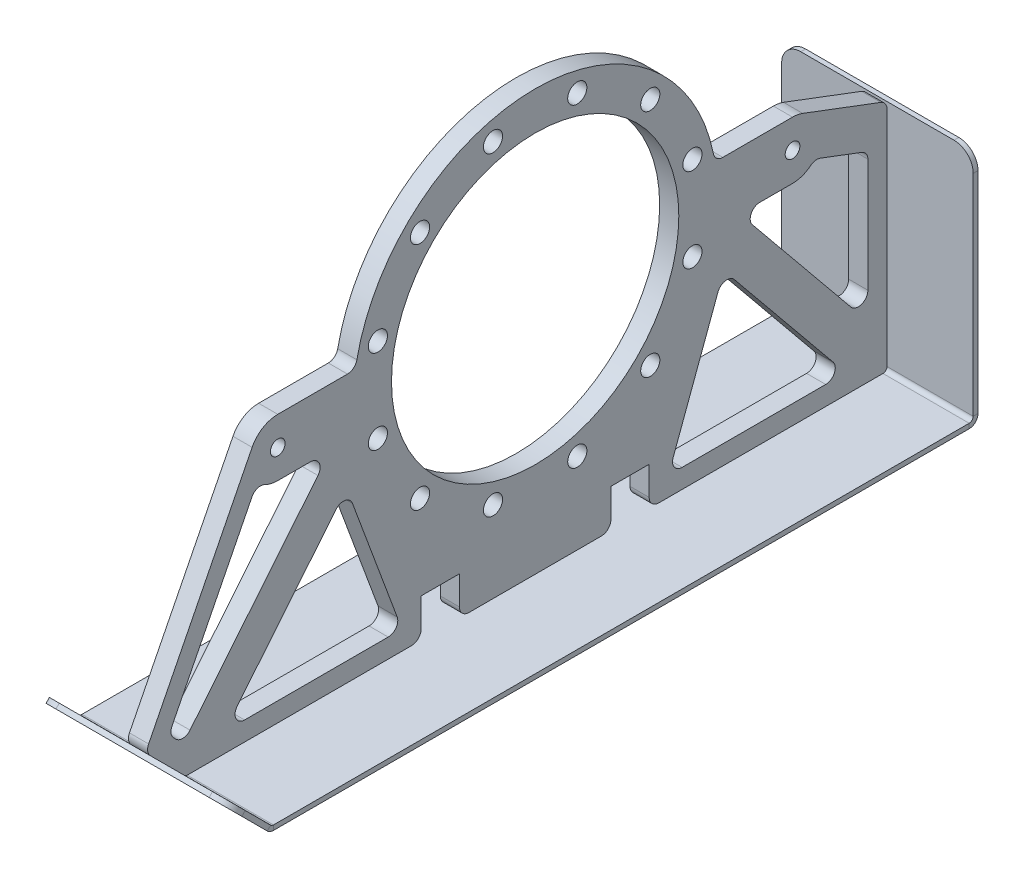
from build123d import *

# Parameters (mm, degrees)
FLANGE_PROFILE_DEPTH                = 12.7
F_7_8_1_DIAMETER_HOLE1_D            = 25.4
BOLT_PATTERN_COUNT                  = 12
SKETCH15_R                          = 9.72312
BOSS_EXTRUDE1_DEPTH                 = 12.7
SKETCH5_W                           = 254
SKETCH5_H                           = 1317.865260112
BASE_SKID_DEPTH                     = 6.35
BEND_START                          = -127
BEND_HEEL_DEPTH                     = 254
BEND_HEEL_2_DEPTH                   = 254
BEND_TOE_DEPTH                      = 254
BEND_TOE_2_DEPTH                    = 254
WEBBING_EXTRUDE_DEPTH               = 12.7
WEBBING_FILLET_R                    = 12.7
SKID_START                          = -472.929130056
SKID_EDGES_DEPTH                    = 6.35
SKID_START_2                        = -334.061851681
SKID_EDGES_2_DEPTH                  = 6.35
FLANGE_FILLET_R                     = 12.7
CONVERT_START                       = -12.7
CONVERT_FLANGE_TO_SHEET_OUTLINE_R   = 12.7
CONVERT_FLANGE_TO_SHEET_OUTLINE_R_2 = 9.72312
CONVERT_FLANGE_TO_SHEET_OUTLINE_R_3 = 190.5
CONVERT_FLANGE_TO_SHEET_DEPTH       = 25.4


# Read off the part's stored shape, not the designer's step: Bend Heel, Bend Toe, Skid Edges, Convert Flange to Sheet
# Sheet-metal steps are written as plain solids
with BuildPart() as part:
    # Sketch1 → Flange Profile (new, symmetric)
    with BuildSketch(Plane(origin=(0, 0, 0), x_dir=(0, 0, -1), z_dir=(1, 0, 0))):
        with BuildLine():
            ThreePointArc((-190.5, 316.3), (0, 506.8), (190.5, 316.3))
            Line((190.5, 316.3), (241.3, 316.3))
            ThreePointArc((241.3, 316.3), (0, 557.6), (-241.3, 316.3))
            Line((-241.3, 316.3), (-190.5, 316.3))
        make_face()
        with BuildLine():
            Line((241.3, 316.3), (190.5, 316.3))
            ThreePointArc((190.5, 316.3), (0, 125.8), (-190.5, 316.3))
            Line((-190.5, 316.3), (-241.3, 316.3))
            ThreePointArc((-241.3, 316.3), (0, 75), (241.3, 316.3))
        make_face()
    extrude(amount=FLANGE_PROFILE_DEPTH, both=True)

    # 7/8 (1) Diameter Hole1 (through all)
    with Locations(Plane(origin=(12.7, 260.420968162, -208.543385896), x_dir=(0, 0, 1), z_dir=(1, 0, 0))):
        with Locations((0, 0)):
            f_7_8_1_diameter_hole1 = Hole(F_7_8_1_DIAMETER_HOLE1_D / 2)

    # Bolt Pattern: 7/8 (1) Diameter Hole1 ×12 about axis
    bolt_pattern_axis = Axis((0, 316.3, 0), (1, 0, 0))
    for i in range(1, BOLT_PATTERN_COUNT):
        add(f_7_8_1_diameter_hole1.rotate(bolt_pattern_axis, i * 360 / BOLT_PATTERN_COUNT), mode=Mode.SUBTRACT)

    # Sketch15 → Boss-Extrude1 (add, symmetric)
    with BuildSketch(Plane(origin=(0, 0, 0), x_dir=(0, 0, -1), z_dir=(1, 0, 0))):
        with BuildLine():
            Line((-238.273120599, 278.2), (-341.3, 278.2))
            ThreePointArc((-341.3, 278.2), (-379.4, 316.3), (-341.3, 354.4))
            Line((-341.3, 354.4), (-238.273120599, 354.4))
            ThreePointArc((-238.273120599, 354.4), (-200.173120599, 316.3), (-238.273120599, 278.2))
        make_face()
        with Locations((-341.3, 316.3)):
            Circle(SKETCH15_R, mode=Mode.SUBTRACT)
    boss_extrude1 = extrude(amount=BOSS_EXTRUDE1_DEPTH, both=True)

    # Mirror2: Boss-Extrude1 across plane
    add(boss_extrude1.mirror(Plane.XY))

    # webbing → Webbing Extrude (add, symmetric)
    with BuildSketch(Plane(origin=(0, 0, 0), x_dir=(0, 0, -1), z_dir=(1, 0, 0))):
        with BuildLine():
            ThreePointArc((238.273120599, 278.2), (0, 75), (-238.273120599, 278.2))
            Line((-238.273120599, 278.2), (-271.07641131, 278.2))
            Line((-271.07641131, 278.2), (-466.535353829, 39.001833116))
            Line((-466.535353829, 39.001833116), (-485.744094857, 58.210574144))
            Line((-485.744094857, 58.210574144), (-380.664844281, 266.473711409))
            Line((-380.664844281, 266.473711409), (-368.819522655, 289.950695021))
            ThreePointArc((-368.819522655, 289.950695021), (-378.982374479, 310.674286388), (-375.315537192, 333.462553119))
            Line((-375.315537192, 333.462553119), (-516.69946035, 53.244915153))
            Line((-516.69946035, 53.244915153), (-465.016837626, 1.562292429))
            ThreePointArc((-465.016837626, 1.562292429), (-463.286363484, 0.406026574), (-461.245130056, 0))
            Line((-461.245130056, 0), (-151.213153751, 0))
            Line((-151.213153751, 0), (-151.213153751, 50.8))
            Line((-151.213153751, 50.8), (-100.413153751, 50.8))
            Line((-100.413153751, 50.8), (-100.413153751, 0))
            Line((-100.413153751, 0), (100.413153751, 0))
            Line((100.413153751, 0), (100.413153751, 50.8))
            Line((100.413153751, 50.8), (151.213153751, 50.8))
            Line((151.213153751, 50.8), (151.213153751, 0))
            Line((151.213153751, 0), (176.613153751, 0))
            Line((176.613153751, 0), (461.245130056, 0))
            ThreePointArc((461.245130056, 0), (465.016837626, 1.562292429), (466.579130056, 5.334))
            Line((466.579130056, 5.334), (466.579130056, 309.66453199))
            Line((466.579130056, 309.66453199), (354.774573435, 351.937702939))
            ThreePointArc((354.774573435, 351.937702939), (378.177611201, 325.873494246), (370.408024073, 291.716816021))
            Line((370.408024073, 291.716816021), (441.179130056, 264.958344347))
            Line((441.179130056, 264.958344347), (441.179130056, 70.03219769))
            Line((441.179130056, 70.03219769), (271.07641131, 278.2))
            Line((271.07641131, 278.2), (238.273120599, 278.2))
        make_face()
        Polygon((-176.613153751, 25.4), (-412.046717792, 25.4), (-250.076782577, 223.615088522), align=None, mode=Mode.SUBTRACT)
        Polygon((412.046717792, 25.4), (176.613153751, 25.4), (250.076782577, 223.615088522), align=None, mode=Mode.SUBTRACT)
    extrude(amount=WEBBING_EXTRUDE_DEPTH, both=True)

    # Webbing Fillet
    webbing_fillet_edges = [part.edges().sort_by_distance(p)[0] for p in [
        (0, 25.4, 412.046717792),
        (0, 223.615088522, 250.076782577),
        (0, 289.950695021, 368.819522655),
        (0, 291.716816021, -370.408024073),
        (0, 264.958344347, -441.179130056),
        (0, 70.03219769, -441.179130056),
        (0, 278.2, -271.07641131),
        (0, 278.2, 271.07641131),
        (0, 39.001833116, 466.535353829),
        (0, 25.4, -412.046717792),
        (0, 25.4, -176.613153751),
        (0, 58.210574144, 485.744094857),
        (0, 223.615088522, -250.076782577),
        (0, 25.4, 176.613153751),
    ]]
    fillet(webbing_fillet_edges, radius=WEBBING_FILLET_R)

    # Flange Fillet
    flange_fillet_edges = [part.edges().sort_by_distance(p)[0] for p in [
        (0, 53.244915153, 516.69946035),
        (0, 0, 151.213153751),
        (0, 0, 100.413153751),
        (0, 0, -100.413153751),
        (0, 0, -151.213153751),
        (0, 309.66453199, -466.579130056),
        (0, 354.4, 238.273120599),
        (0, 354.4, -238.273120599),
    ]]
    fillet(flange_fillet_edges, radius=FLANGE_FILLET_R)


with BuildPart() as body_2:
    # Sketch5 → Base Skid (new body)
    with BuildSketch(Plane(origin=(0, 0, 0), x_dir=(1, 0, 0), z_dir=(0, 1, 0))):
        with Locations((0, 118.6125)):
            Rectangle(SKETCH5_W, SKETCH5_H)
    extrude(amount=-BASE_SKID_DEPTH)

    # Bend Heel outline → Bend Heel (cut)
    with BuildSketch(Plane.YZ.offset(BEND_START)):
        with BuildLine():
            Line((0, -777.545130056), (0, -471.640528076))
            ThreePointArc((0, -471.640528076), (-4.636915504, -467.33583609), (-6.35, -461.245130056))
            Line((-6.35, -461.245130056), (-6.35, -777.545130056))
            Line((-6.35, -777.545130056), (0, -777.545130056))
        make_face()
    extrude(amount=BEND_HEEL_DEPTH, mode=Mode.SUBTRACT)

    # Bend Heel 2 outline → Bend Heel 2 (add)
    with BuildSketch(Plane.YZ.offset(BEND_START)):
        with BuildLine():
            Line((5.334, -472.929130056), (309.66453199, -472.929130056))
            Line((309.66453199, -472.929130056), (309.66453199, -466.579130056))
            Line((309.66453199, -466.579130056), (5.334, -466.579130056))
            ThreePointArc((5.334, -466.579130056), (1.56229243, -465.016837626), (0, -461.245130056))
            Line((0, -461.245130056), (0, -471.640528076))
            ThreePointArc((0, -471.640528076), (2.590277571, -472.602411563), (5.334, -472.929130056))
        make_face()
    extrude(amount=BEND_HEEL_2_DEPTH)

    # Bend Toe outline → Bend Toe (cut)
    with BuildSketch(Plane.YZ.offset(BEND_START)):
        with BuildLine():
            Line((-6.35, 540.320130056), (-6.35, 461.245130056))
            ThreePointArc((-6.35, 461.245130056), (-5.460608458, 465.71640328), (-2.927835631, 469.506965687))
            Line((-2.927835631, 469.506965687), (0, 472.434801318))
            Line((0, 472.434801318), (0, 540.320130056))
            Line((0, 540.320130056), (-6.35, 540.320130056))
        make_face()
    extrude(amount=BEND_TOE_DEPTH, mode=Mode.SUBTRACT)

    # Bend Toe 2 outline → Bend Toe 2 (add)
    with BuildSketch(Plane.YZ.offset(BEND_START)):
        with BuildLine():
            Line((48.754787092, 521.189588411), (0, 472.434801318))
            Line((0, 472.434801318), (0, 461.245130056))
            ThreePointArc((0, 461.245130056), (0.406026574, 463.286363484), (1.562292429, 465.016837626))
            Line((1.562292429, 465.016837626), (53.244915153, 516.69946035))
            Line((53.244915153, 516.69946035), (48.754787092, 521.189588411))
        make_face()
    extrude(amount=BEND_TOE_2_DEPTH)

    # Skid Edges outline → Skid Edges (cut)
    with BuildSketch(Plane.XY.offset(SKID_START)):
        with BuildLine():
            ThreePointArc((-127, 284.26453199), (-119.560512242, 302.225044232), (-101.6, 309.66453199))
            Line((-101.6, 309.66453199), (-127, 309.66453199))
            Line((-127, 309.66453199), (-127, 284.26453199))
        make_face()
        with BuildLine():
            ThreePointArc((101.6, 309.66453199), (119.560512242, 302.225044232), (127, 284.26453199))
            Line((127, 284.26453199), (127, 309.66453199))
            Line((127, 309.66453199), (101.6, 309.66453199))
        make_face()
    extrude(amount=SKID_EDGES_DEPTH, mode=Mode.SUBTRACT)

    # Skid Edges 2 outline → Skid Edges 2 (cut)
    with BuildSketch(Plane(origin=(0, 0, 0), x_dir=(1, 0, 0), z_dir=(0, 0.707106781186546, -0.707106781186549)).offset(SKID_START_2)):
        with BuildLine():
            Line((-127, -403.011532817), (-101.6, -403.011532817))
            ThreePointArc((-101.6, -403.011532817), (-119.560512242, -395.572045059), (-127, -377.611532817))
            Line((-127, -377.611532817), (-127, -403.011532817))
        make_face()
        with BuildLine():
            ThreePointArc((127, -377.611532817), (119.560512242, -395.572045059), (101.6, -403.011532817))
            Line((101.6, -403.011532817), (127, -403.011532817))
            Line((127, -403.011532817), (127, -377.611532817))
        make_face()
    extrude(amount=SKID_EDGES_2_DEPTH, mode=Mode.SUBTRACT)


with BuildPart() as body_3:
    # Convert Flange to Sheet outline → Convert Flange to Sheet (new body)
    with BuildSketch(Plane.YZ.offset(CONVERT_START)):
        with BuildLine():
            ThreePointArc((354.4, 341.3), (348.746134391, 361.271438683), (333.462553119, 375.315537192))
            Line((333.462553119, 375.315537192), (61.448595688, 512.560290001))
            ThreePointArc((61.448595688, 512.560290001), (53.716209529, 513.761463663), (46.747488527, 510.202033725))
            Line((46.747488527, 510.202033725), (1.562292429, 465.016837626))
            ThreePointArc((1.562292429, 465.016837626), (0.406026574, 463.286363484), (0, 461.245130056))
            Line((0, 461.245130056), (0, 163.913153751))
            ThreePointArc((0, 163.913153751), (3.719743879, 154.93289763), (12.7, 151.213153751))
            Line((12.7, 151.213153751), (50.8, 151.213153751))
            Line((50.8, 151.213153751), (50.8, 100.413153751))
            Line((50.8, 100.413153751), (12.7, 100.413153751))
            ThreePointArc((12.7, 100.413153751), (3.719743879, 96.693409872), (0, 87.713153751))
            Line((0, 87.713153751), (0, -87.713153751))
            ThreePointArc((0, -87.713153751), (3.719743879, -96.693409872), (12.7, -100.413153751))
            Line((12.7, -100.413153751), (50.8, -100.413153751))
            Line((50.8, -100.413153751), (50.8, -151.213153751))
            Line((50.8, -151.213153751), (12.7, -151.213153751))
            ThreePointArc((12.7, -151.213153751), (3.719743879, -154.93289763), (0, -163.913153751))
            Line((0, -163.913153751), (0, -461.245130056))
            ThreePointArc((0, -461.245130056), (1.56229243, -465.016837626), (5.334, -466.579130056))
            Line((5.334, -466.579130056), (300.888912587, -466.579130056))
            ThreePointArc((300.888912587, -466.579130056), (308.108595375, -464.327392133), (312.7681469, -458.370654534))
            Line((312.7681469, -458.370654534), (351.937702939, -354.774573435))
            ThreePointArc((351.937702939, -354.774573435), (353.779370872, -348.148850927), (354.4, -341.3))
            Line((354.4, -341.3), (354.4, -248.868157867))
            ThreePointArc((354.4, -248.868157867), (357.262622301, -240.83597261), (364.56, -236.424749973))
            ThreePointArc((364.56, -236.424749973), (557.6, 0), (364.56, 236.424749973))
            ThreePointArc((364.56, 236.424749973), (357.262622301, 240.83597261), (354.4, 248.868157867))
            Line((354.4, 248.868157867), (354.4, 341.3))
        make_face()
        with BuildLine():
            ThreePointArc((46.135994814, -395.102459099), (32.65790179, -396.74310345), (25.4, -385.26819312))
            Line((25.4, -385.26819312), (25.4, -194.864301774))
            ThreePointArc((25.4, -194.864301774), (30.846114958, -184.439756133), (42.513567213, -182.955883556))
            Line((42.513567213, -182.955883556), (202.817491303, -242.368656148))
            ThreePointArc((202.817491303, -242.368656148), (210.931253322, -252.189965766), (206.439918904, -264.111340345))
            Line((206.439918904, -264.111340345), (46.135994814, -395.102459099))
        make_face(mode=Mode.SUBTRACT)
        with BuildLine():
            ThreePointArc((257.464005186, -288.020670003), (270.94209821, -286.380025652), (278.2, -297.854935982))
            Line((278.2, -297.854935982), (278.2, -341.3))
            ThreePointArc((278.2, -341.3), (280.417487243, -354.108406547), (286.811825631, -365.42586936))
            ThreePointArc((286.811825631, -365.42586936), (289.515915106, -371.417982957), (288.861668487, -377.959350292))
            Line((288.861668487, -377.959350292), (268.061959257, -432.970654534))
            ThreePointArc((268.061959257, -432.970654534), (263.402407732, -438.927392133), (256.182724944, -441.179130056))
            Line((256.182724944, -441.179130056), (105.645109911, -441.179130056))
            ThreePointArc((105.645109911, -441.179130056), (93.682978455, -432.744972415), (97.609115097, -418.644864077))
            Line((97.609115097, -418.644864077), (257.464005186, -288.020670003))
        make_face(mode=Mode.SUBTRACT)
        with Locations((107.756614104, -55.879031838)):
            Circle(CONVERT_FLANGE_TO_SHEET_OUTLINE_R, mode=Mode.SUBTRACT)
        with Locations((163.635645942, -152.664354058)):
            Circle(CONVERT_FLANGE_TO_SHEET_OUTLINE_R, mode=Mode.SUBTRACT)
        with Locations((260.420968162, -208.543385896)):
            Circle(CONVERT_FLANGE_TO_SHEET_OUTLINE_R, mode=Mode.SUBTRACT)
        with Locations((316.3, -341.3)):
            Circle(CONVERT_FLANGE_TO_SHEET_OUTLINE_R_2, mode=Mode.SUBTRACT)
        with Locations((372.179031838, -208.543385896)):
            Circle(CONVERT_FLANGE_TO_SHEET_OUTLINE_R, mode=Mode.SUBTRACT)
        with Locations((316.3, 0)):
            Circle(CONVERT_FLANGE_TO_SHEET_OUTLINE_R_3, mode=Mode.SUBTRACT)
        with Locations((468.964354058, -152.664354058)):
            Circle(CONVERT_FLANGE_TO_SHEET_OUTLINE_R, mode=Mode.SUBTRACT)
        with Locations((524.843385896, -55.879031838)):
            Circle(CONVERT_FLANGE_TO_SHEET_OUTLINE_R, mode=Mode.SUBTRACT)
        with Locations((107.756614104, 55.879031838)):
            Circle(CONVERT_FLANGE_TO_SHEET_OUTLINE_R, mode=Mode.SUBTRACT)
        with Locations((163.635645942, 152.664354058)):
            Circle(CONVERT_FLANGE_TO_SHEET_OUTLINE_R, mode=Mode.SUBTRACT)
        with Locations((260.420968162, 208.543385896)):
            Circle(CONVERT_FLANGE_TO_SHEET_OUTLINE_R, mode=Mode.SUBTRACT)
        with BuildLine():
            Line((46.135994814, 395.102459099), (206.439918904, 264.111340345))
            ThreePointArc((206.439918904, 264.111340345), (210.931253322, 252.189965766), (202.817491303, 242.368656148))
            Line((202.817491303, 242.368656148), (42.513567213, 182.955883556))
            ThreePointArc((42.513567213, 182.955883556), (30.846114958, 184.439756133), (25.4, 194.864301774))
            Line((25.4, 194.864301774), (25.4, 385.26819312))
            ThreePointArc((25.4, 385.26819312), (32.65790179, 396.74310345), (46.135994814, 395.102459099))
        make_face(mode=Mode.SUBTRACT)
        with BuildLine():
            ThreePointArc((282.284462808, 358.462553119), (279.235178626, 350.120941928), (278.2, 341.3))
            Line((278.2, 341.3), (278.2, 297.854935982))
            ThreePointArc((278.2, 297.854935982), (270.94209821, 286.380025652), (257.464005186, 288.020670003))
            Line((257.464005186, 288.020670003), (49.87538072, 457.650118027))
            ThreePointArc((49.87538072, 457.650118027), (45.227339921, 466.847798927), (48.931119413, 476.464640127))
            Line((48.931119413, 476.464640127), (51.713147519, 479.246668232))
            ThreePointArc((51.713147519, 479.246668232), (58.68186852, 482.80609817), (66.414254679, 481.604924508))
            Line((66.414254679, 481.604924508), (276.666801451, 375.521916556))
            ThreePointArc((276.666801451, 375.521916556), (283.00874198, 368.155690599), (282.284462808, 358.462553119))
        make_face(mode=Mode.SUBTRACT)
        with Locations((372.179031838, 208.543385896)):
            Circle(CONVERT_FLANGE_TO_SHEET_OUTLINE_R, mode=Mode.SUBTRACT)
        with Locations((524.843385896, 55.879031838)):
            Circle(CONVERT_FLANGE_TO_SHEET_OUTLINE_R, mode=Mode.SUBTRACT)
        with Locations((468.964354058, 152.664354058)):
            Circle(CONVERT_FLANGE_TO_SHEET_OUTLINE_R, mode=Mode.SUBTRACT)
        with Locations((316.3, 341.3)):
            Circle(CONVERT_FLANGE_TO_SHEET_OUTLINE_R_2, mode=Mode.SUBTRACT)
    extrude(amount=CONVERT_FLANGE_TO_SHEET_DEPTH)


solid = Compound([body_2.part, body_3.part])
